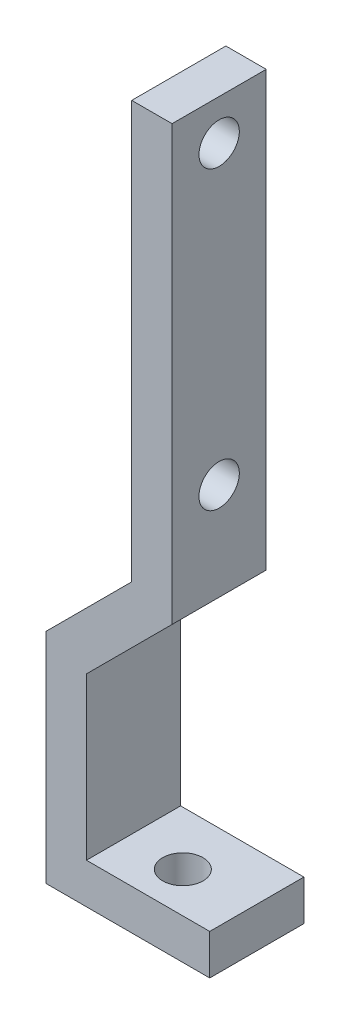
from build123d import *

# Parameters (mm, degrees)
EXTRUDE_1_DEPTH     = 7
SKETCH_2_R          = 1.5
CUT_EXTRUDE_2_DEPTH = 7
SKETCH_4_R          = 1.5
CUT_EXTRUDE_3_DEPTH = 7


with BuildPart() as part:
    # 草图1 → 凸台-拉伸1 (new body)
    with BuildSketch(Plane.XY):
        Polygon((-0.641080243, 21.986723194), (-3.641080243, 21.986723194), (-3.641080243, -9.013276806), (-10.005041274, -15.377237837), (-10.005041274, -31.619878524), (2.158919757, -31.619878524), (2.158919757, -28.619878524), (-7.005041274, -28.619878524), (-7.005041274, -16.619878524), (-0.641080243, -10.255917493), align=None)
    extrude(amount=EXTRUDE_1_DEPTH)

    # 草图2 → 切除-拉伸2 (cut)
    with BuildSketch(Plane.ZY.offset(3.641080243)):
        with Locations((3.5, 18.986723194)):
            Circle(SKETCH_2_R)
        with Locations((3.5, -3.013276806)):
            Circle(SKETCH_2_R)
    extrude(amount=-CUT_EXTRUDE_2_DEPTH, mode=Mode.SUBTRACT)

    # 草图4 → 切除-拉伸3 (cut)
    with BuildSketch(Plane(origin=(0, -28.619878524, 0), x_dir=(1, 0, 0), z_dir=(0, 1, 0))):
        with Locations((-2.841080243, -4)):
            Circle(SKETCH_4_R)
    extrude(amount=-CUT_EXTRUDE_3_DEPTH, mode=Mode.SUBTRACT)


solid = part.part
